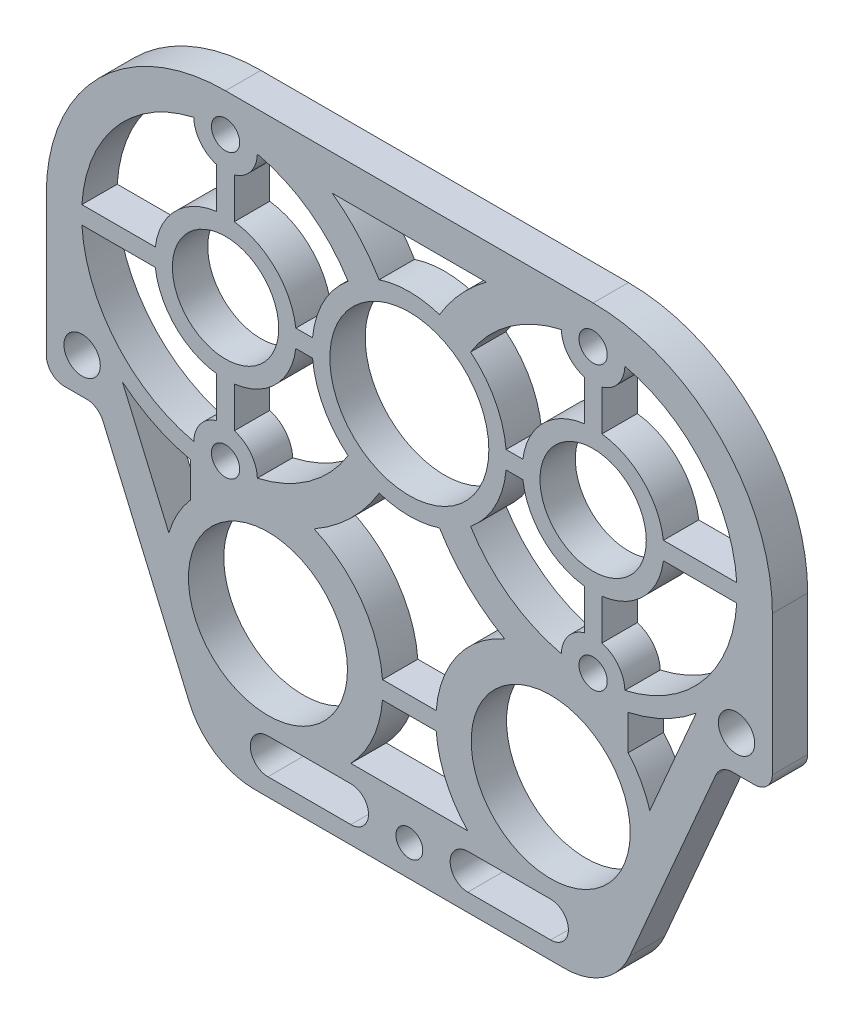
from build123d import *

# Parameters (mm, degrees)
SKETCH1_R           = 2.413
SKETCH1_R_2         = 3.2639
SKETCH1_R_3         = 2.54
SKETCH1_R_4         = 14.2875
SKETCH1_R_5         = 9.5504
BOSS_EXTRUDE1_DEPTH = 6.35
FILLET1_R           = 12.7


with BuildPart() as part:
    # Sketch1 → Boss-Extrude1 (new body)
    with BuildSketch(Plane.XY):
        with BuildLine():
            Line((-79.774622093, -96.086946138), (-69.089278393, -120.875011159))
            Line((-69.089278393, -120.875011159), (-60.977424177, -139.773032707))
            Line((-60.977424177, -139.773032707), (11.502231084, -139.773032707))
            Line((11.502231084, -139.773032707), (19.6140853, -120.954997894))
            Line((19.6140853, -120.954997894), (30.299429001, -96.166932873))
            ThreePointArc((30.299429001, -96.166932873), (31.469879599, -94.705078892), (33.255891369, -94.141932707))
            Line((33.255891369, -94.141932707), (37.270153454, -94.141932707))
            ThreePointArc((37.270153454, -94.141932707), (39.518829047, -93.227430747), (40.489603454, -91.002469442))
            Line((40.489603454, -91.002469442), (40.489603454, -65.881422013))
            ThreePointArc((40.489603454, -65.881422013), (31.056332977, -43.10749249), (8.282403454, -33.674222013))
            Line((8.282403454, -33.674222013), (-57.757596546, -33.674222013))
            ThreePointArc((-57.757596546, -33.674222013), (-80.531526069, -43.10749249), (-89.964796546, -65.881422013))
            Line((-89.964796546, -65.881422013), (-89.964796546, -90.922482707))
            ThreePointArc((-89.964796546, -90.922482707), (-89.021841473, -93.198977634), (-86.745346546, -94.141932707))
            Line((-86.745346546, -94.141932707), (-82.731084461, -94.141932707))
            ThreePointArc((-82.731084461, -94.141932707), (-80.96163914, -94.671787652), (-79.774622093, -96.086946138))
        make_face()
        with BuildLine():
            ThreePointArc((-35.245526509, -130.248032707), (-32.070526509, -133.423032707), (-35.245526509, -136.598032707))
            Line((-35.245526509, -136.598032707), (-50.137596546, -136.598032707))
            ThreePointArc((-50.137596546, -136.598032707), (-53.312596546, -133.423032707), (-50.137596546, -130.248032707))
            Line((-50.137596546, -130.248032707), (-35.245526509, -130.248032707))
        make_face(mode=Mode.SUBTRACT)
        with Locations((-24.737596546, -134.185032707)):
            Circle(SKETCH1_R, mode=Mode.SUBTRACT)
        with Locations((-83.525896546, -87.703032707)):
            Circle(SKETCH1_R_2, mode=Mode.SUBTRACT)
        with BuildLine():
            Line((-67.944397243, -107.569702871), (-76.276797737, -88.240040577))
            ThreePointArc((-76.276797737, -88.240040577), (-70.522345888, -91.956885788), (-64.057187193, -94.221919442))
            Line((-64.057187193, -94.221919442), (-64.057187193, -100.51638326))
            ThreePointArc((-64.057187193, -100.51638326), (-66.388082887, -103.829600281), (-67.944397243, -107.569702871))
        make_face(mode=Mode.SUBTRACT)
        with Locations((-57.757596546, -91.281422013)):
            Circle(SKETCH1_R_3, mode=Mode.SUBTRACT)
        with Locations((-50.137596546, -112.785532707)):
            Circle(SKETCH1_R_4, mode=Mode.SUBTRACT)
        with BuildLine():
            ThreePointArc((0.662403454, -130.248032707), (3.837403454, -133.423032707), (0.662403454, -136.598032707))
            Line((0.662403454, -136.598032707), (-14.229666584, -136.598032707))
            ThreePointArc((-14.229666584, -136.598032707), (-17.404666584, -133.423032707), (-14.229666584, -130.248032707))
            Line((-14.229666584, -130.248032707), (0.662403454, -130.248032707))
        make_face(mode=Mode.SUBTRACT)
        with BuildLine():
            ThreePointArc((-19.913948264, -114.373032707), (-18.174388615, -121.216527358), (-14.229666584, -127.073032707))
            Line((-14.229666584, -127.073032707), (-35.245526509, -127.073032707))
            ThreePointArc((-35.245526509, -127.073032707), (-31.300804477, -121.216527358), (-29.561244829, -114.373032707))
            Line((-29.561244829, -114.373032707), (-19.913948264, -114.373032707))
        make_face(mode=Mode.SUBTRACT)
        with Locations((0.662403454, -112.785532707)):
            Circle(SKETCH1_R_4, mode=Mode.SUBTRACT)
        with BuildLine():
            Line((-19.913948264, -111.198032707), (-29.561244829, -111.198032707))
            ThreePointArc((-29.561244829, -111.198032707), (-33.30837049, -100.840510455), (-41.849292426, -93.885521568))
            ThreePointArc((-41.849292426, -93.885521568), (-35.26870111, -88.93686202), (-30.157880835, -82.481404678))
            ThreePointArc((-30.157880835, -82.481404678), (-24.737596546, -83.343922013), (-19.317312258, -82.481404678))
            ThreePointArc((-19.317312258, -82.481404678), (-14.206491982, -88.93686202), (-7.625900666, -93.885521568))
            ThreePointArc((-7.625900666, -93.885521568), (-16.166822602, -100.840510455), (-19.913948264, -111.198032707))
        make_face(mode=Mode.SUBTRACT)
        with BuildLine():
            Line((14.581994101, -100.51638326), (14.581994101, -94.221919442))
            ThreePointArc((14.581994101, -94.221919442), (21.047152796, -91.956885788), (26.801604645, -88.240040577))
            Line((26.801604645, -88.240040577), (18.469204151, -107.569702871))
            ThreePointArc((18.469204151, -107.569702871), (16.912889794, -103.829600281), (14.581994101, -100.51638326))
        make_face(mode=Mode.SUBTRACT)
        with Locations((8.282403454, -91.281422013)):
            Circle(SKETCH1_R_3, mode=Mode.SUBTRACT)
        with Locations((34.050703454, -87.703032707)):
            Circle(SKETCH1_R_2, mode=Mode.SUBTRACT)
        with BuildLine():
            Line((-59.345096546, -78.50741302), (-59.345096546, -85.791333785))
            ThreePointArc((-59.345096546, -85.791333785), (-62.270471472, -87.774972968), (-63.469709832, -91.099799313))
            ThreePointArc((-63.469709832, -91.099799313), (-77.455074137, -82.632665799), (-83.566018342, -67.468922013))
            Line((-83.566018342, -67.468922013), (-70.383587553, -67.468922013))
            ThreePointArc((-70.383587553, -67.468922013), (-66.755813179, -74.879638646), (-59.345096546, -78.50741302))
        make_face(mode=Mode.SUBTRACT)
        with Locations((-57.757596546, -65.881422013)):
            Circle(SKETCH1_R_5, mode=Mode.SUBTRACT)
        with BuildLine():
            ThreePointArc((-52.04548326, -91.099799313), (-53.24472162, -87.774972968), (-56.170096546, -85.791333785))
            Line((-56.170096546, -85.791333785), (-56.170096546, -78.50741302))
            ThreePointArc((-56.170096546, -78.50741302), (-48.759379913, -74.879638646), (-45.131605539, -67.468922013))
            Line((-45.131605539, -67.468922013), (-42.127787747, -67.468922013))
            ThreePointArc((-42.127787747, -67.468922013), (-40.144805677, -74.10071718), (-35.740996219, -79.441071783))
            ThreePointArc((-35.740996219, -79.441071783), (-42.717587518, -86.914560635), (-52.04548326, -91.099799313))
        make_face(mode=Mode.SUBTRACT)
        with Locations((-24.737596546, -65.881422013)):
            Circle(SKETCH1_R_4, mode=Mode.SUBTRACT)
        with BuildLine():
            ThreePointArc((-59.345096546, -53.255431006), (-66.755813179, -56.88320538), (-70.383587553, -64.293922013))
            Line((-70.383587553, -64.293922013), (-83.566018342, -64.293922013))
            ThreePointArc((-83.566018342, -64.293922013), (-77.455074137, -49.130178227), (-63.469709832, -40.663044713))
            ThreePointArc((-63.469709832, -40.663044713), (-62.270471472, -43.987871058), (-59.345096546, -45.971510241))
            Line((-59.345096546, -45.971510241), (-59.345096546, -53.255431006))
        make_face(mode=Mode.SUBTRACT)
        with Locations((-57.757596546, -40.481422013)):
            Circle(SKETCH1_R_3, mode=Mode.SUBTRACT)
        with BuildLine():
            Line((-56.170096546, -53.255431006), (-56.170096546, -45.971510241))
            ThreePointArc((-56.170096546, -45.971510241), (-53.24472162, -43.987871058), (-52.04548326, -40.663044713))
            ThreePointArc((-52.04548326, -40.663044713), (-42.717587518, -44.848283391), (-35.740996219, -52.321772243))
            ThreePointArc((-35.740996219, -52.321772243), (-40.144805677, -57.662126846), (-42.127787747, -64.293922013))
            Line((-42.127787747, -64.293922013), (-45.131605539, -64.293922013))
            ThreePointArc((-45.131605539, -64.293922013), (-48.759379913, -56.88320538), (-56.170096546, -53.255431006))
        make_face(mode=Mode.SUBTRACT)
        with BuildLine():
            Line((-38.555801318, -40.024222013), (-10.919391775, -40.024222013))
            ThreePointArc((-10.919391775, -40.024222013), (-15.571723543, -44.241543153), (-19.317312258, -49.281439348))
            ThreePointArc((-19.317312258, -49.281439348), (-24.737596546, -48.418922013), (-30.157880835, -49.281439348))
            ThreePointArc((-30.157880835, -49.281439348), (-33.90346955, -44.241543153), (-38.555801318, -40.024222013))
        make_face(mode=Mode.SUBTRACT)
        with BuildLine():
            Line((-7.347405345, -67.468922013), (-4.343587553, -67.468922013))
            ThreePointArc((-4.343587553, -67.468922013), (-0.715813179, -74.879638646), (6.694903454, -78.50741302))
            Line((6.694903454, -78.50741302), (6.694903454, -85.791333785))
            ThreePointArc((6.694903454, -85.791333785), (3.769528528, -87.774972968), (2.570290168, -91.099799313))
            ThreePointArc((2.570290168, -91.099799313), (-6.757605574, -86.914560635), (-13.734196873, -79.441071783))
            ThreePointArc((-13.734196873, -79.441071783), (-9.330387415, -74.10071718), (-7.347405345, -67.468922013))
        make_face(mode=Mode.SUBTRACT)
        with BuildLine():
            ThreePointArc((9.869903454, -78.50741302), (17.280620087, -74.879638646), (20.908394461, -67.468922013))
            Line((20.908394461, -67.468922013), (34.09082525, -67.468922013))
            ThreePointArc((34.09082525, -67.468922013), (27.979881045, -82.632665799), (13.99451674, -91.099799313))
            ThreePointArc((13.99451674, -91.099799313), (12.79527838, -87.774972968), (9.869903454, -85.791333785))
            Line((9.869903454, -85.791333785), (9.869903454, -78.50741302))
        make_face(mode=Mode.SUBTRACT)
        with Locations((8.282403454, -65.881422013)):
            Circle(SKETCH1_R_5, mode=Mode.SUBTRACT)
        with BuildLine():
            ThreePointArc((6.694903454, -53.255431006), (-0.715813179, -56.88320538), (-4.343587553, -64.293922013))
            Line((-4.343587553, -64.293922013), (-7.347405345, -64.293922013))
            ThreePointArc((-7.347405345, -64.293922013), (-9.330387415, -57.662126846), (-13.734196873, -52.321772243))
            ThreePointArc((-13.734196873, -52.321772243), (-6.757605574, -44.848283391), (2.570290168, -40.663044713))
            ThreePointArc((2.570290168, -40.663044713), (3.769528528, -43.987871058), (6.694903454, -45.971510241))
            Line((6.694903454, -45.971510241), (6.694903454, -53.255431006))
        make_face(mode=Mode.SUBTRACT)
        with BuildLine():
            Line((9.869903454, -53.255431006), (9.869903454, -45.971510241))
            ThreePointArc((9.869903454, -45.971510241), (12.79527838, -43.987871058), (13.99451674, -40.663044713))
            ThreePointArc((13.99451674, -40.663044713), (27.979881045, -49.130178227), (34.09082525, -64.293922013))
            Line((34.09082525, -64.293922013), (20.908394461, -64.293922013))
            ThreePointArc((20.908394461, -64.293922013), (17.280620087, -56.88320538), (9.869903454, -53.255431006))
        make_face(mode=Mode.SUBTRACT)
        with Locations((8.282403454, -40.481422013)):
            Circle(SKETCH1_R_3, mode=Mode.SUBTRACT)
    extrude(amount=BOSS_EXTRUDE1_DEPTH)

    # Fillet1
    fillet1_edges = [part.edges().sort_by_distance(p)[0] for p in [
        (11.502231084, -139.773032707, 3.175),
        (-60.977424177, -139.773032707, 3.175),
    ]]
    fillet(fillet1_edges, radius=FILLET1_R)


solid = part.part
